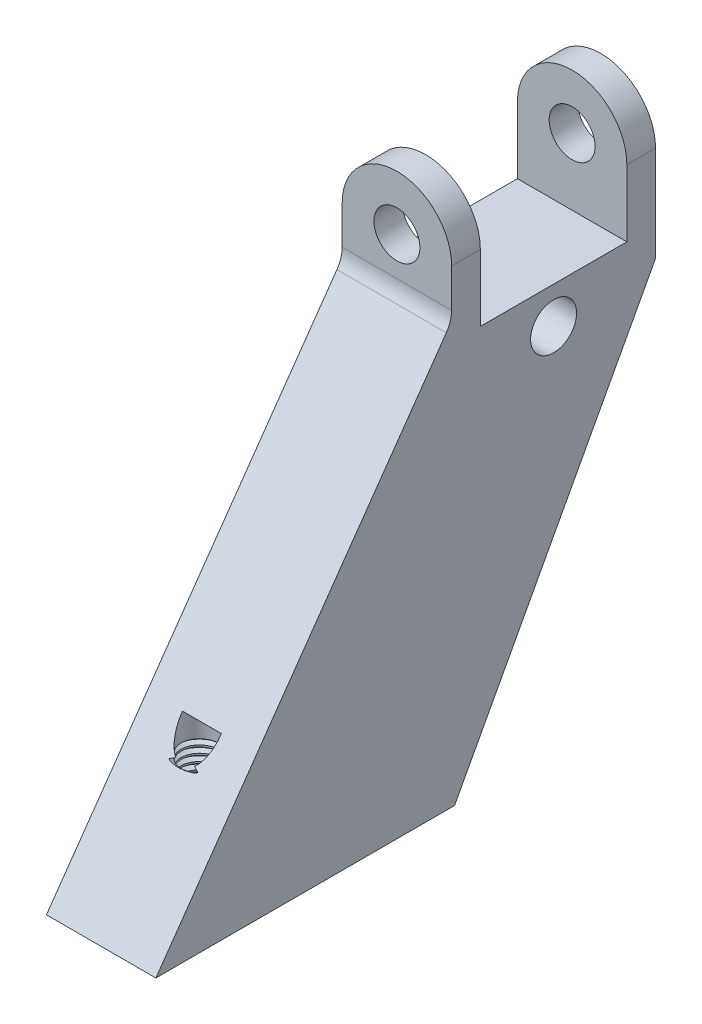
from build123d import *
from build123d.topology import SkipClean

# Parameters (mm, degrees)
SKETCH6_W           = 19.05
SKETCH6_H           = 133.908026583
BOSS_EXTRUDE5_DEPTH = 101.6
SKETCH10_W          = 25.504488372
SKETCH10_H          = 23.275439273
CUT_EXTRUDE6_DEPTH  = 172.247967102
SKETCH12_R          = 4
CUT_EXTRUDE7_DEPTH  = 118.754114563
SKETCH14_R          = 3.4
CUT_EXTRUDE8_DEPTH  = 25
THREAD1_PITCH       = 1.25
THREAD2_PITCH       = 1.25
SKETCH19_R          = 4
CUT_EXTRUDE9_DEPTH  = 130.910986422


with BuildPart() as part:
    # Sketch6 → Boss-Extrude5 (new body)
    with BuildSketch(Plane(origin=(0, 3.43144364, 0), x_dir=(-1, 0, 0), z_dir=(0, 1, 0))):
        with Locations((-3.989422479, 66.954013292)):
            Rectangle(SKETCH6_W, SKETCH6_H)
    extrude(amount=BOSS_EXTRUDE5_DEPTH)

    # Sketch10 → Cut-Extrude6 (cut, through all)
    with BuildSketch(Plane(origin=(13.514422479, 0, 0), x_dir=(0, 0, -1), z_dir=(1, 0, 0))):
        with BuildLine():
            Line((-87.000000104, 3.43144364), (-167.598373303, 3.43144364))
            Line((-167.598373303, 3.43144364), (-168.555842831, 132.882439452))
            Line((-168.555842831, 132.882439452), (-35.504488372, 117.022814853))
            Line((-35.504488372, 117.022814853), (-35.504488372, 78.357297482))
            ThreePointArc((-35.504488372, 78.357297482), (-35.740698196, 76.826253156), (-36.4273611, 75.437589819))
            Line((-36.4273611, 75.437589819), (-87.000000104, 3.43144364))
        make_face()
        Polygon((-35.000000104, 3.43144364), (7.433427186, 3.43144364), (7.433427186, 68.43144364), (0, 68.43144364), align=None)
        with Locations((-17.752244186, 85.069163277)):
            Rectangle(SKETCH10_W, SKETCH10_H)
    extrude(amount=-CUT_EXTRUDE6_DEPTH, mode=Mode.SUBTRACT)

    # Sketch12 → Cut-Extrude7 (cut, through all)
    with BuildSketch(Plane.XY.offset(35.504488372)):
        with Locations((3.989422479, 85.052808464)):
            Circle(SKETCH12_R)
        with BuildLine():
            Line((13.514422479, 85.052808464), (39.943289933, 85.052808464))
            Line((39.943289933, 85.052808464), (39.943289933, 114.808056181))
            Line((39.943289933, 114.808056181), (-16.126426649, 114.808056181))
            Line((-16.126426649, 114.808056181), (-16.126426649, 85.052808464))
            Line((-16.126426649, 85.052808464), (-5.535577521, 85.052808464))
            ThreePointArc((-5.535577521, 85.052808464), (3.989422479, 94.577808464), (13.514422479, 85.052808464))
        make_face()
    extrude(amount=-CUT_EXTRUDE7_DEPTH, mode=Mode.SUBTRACT)

    # Sketch14 → Cut-Extrude8 (cut)
    with BuildSketch(Plane.XZ.offset(-3.43144364)):
        with Locations(Location((3.989422479, 69.500000104, 0), (0, 0, 270))):
            Circle(SKETCH14_R)
        with Locations(Location((3.989422479, 42.500000104, 0), (0, 0, 270))):
            Circle(SKETCH14_R)
    extrude(amount=-CUT_EXTRUDE8_DEPTH, mode=Mode.SUBTRACT)

    # Thread1: the profile of Thread Profile1 profile screwed along a right-hand helix of 16 turns, 8 arcs to a turn; built about Z, then put on its axis
    with SkipClean():  # the faces are left unmerged after this step: merging them gives an invalid solid
        thread1_z = Axis((0, 0, 0), (0, 0, 1))
        thread1_corners = [(3.3997, 0, -0.000173206), (4.076582344, 0, 0.390624998), (4.076582344, 0, 0.546874998), (3.3997, 0, 0.937673201)]
        with BuildLine(mode=Mode.PRIVATE) as thread1_profile:
            Line(thread1_corners[0], thread1_corners[1])
            Line(thread1_corners[1], thread1_corners[2])
            Line(thread1_corners[2], thread1_corners[3])
            Line(thread1_corners[3], thread1_corners[0])
        thread1_cap = Face(thread1_profile.wire())
        thread1_turn_angles = [0, 22.5, 45, 67.5, 90, 112.5, 135, 157.5, 180, 202.5, 225, 247.5, 270, 292.5, 315, 337.5, 360]
        thread1_turn_weights = [1, 0.9238795325112867, 1, 0.9238795325112867, 1, 0.9238795325112867, 1, 0.9238795325112867, 1, 0.9238795325112867, 1, 0.9238795325112867, 1, 0.9238795325112867, 1, 0.9238795325112867, 1]
        thread1_turn_rails = [Edge.make_bspline([Vector(p[0], p[1], 0).rotate(thread1_z, thread1_turn_angles[k]) / thread1_turn_weights[k] + Vector(0, 0, p[2] + THREAD1_PITCH * thread1_turn_angles[k] / 360) for k in range(17)], [0, 0, 0, 1, 1, 2, 2, 3, 3, 4, 4, 5, 5, 6, 6, 7, 7, 8, 8, 8], 2, thread1_turn_weights) for p in thread1_corners]
        thread1_turn_sides = [Face.make_surface_from_curves(thread1_turn_rails[p[0]], thread1_turn_rails[p[1]]) for p in [(0, 1), (1, 2), (2, 3), (3, 0)]]
        thread1 = Plane(origin=(3.989422479, 3.43144364, 42.500000104), x_dir=(1, 0, 0), z_dir=(0, 1, 0)) * Solid(Shell([*[p.moved(Location((0, 0, THREAD1_PITCH * i))) for i in range(16) for p in thread1_turn_sides], thread1_cap, thread1_cap.rotate(thread1_z, 5760).moved(Location((0, 0, THREAD1_PITCH * 5760 / 360)))]))
        add(thread1, mode=Mode.SUBTRACT)

    # Thread2: the profile of Thread Profile2 profile screwed along a right-hand helix of 16 turns, 8 arcs to a turn; built about Z, then put on its axis
    with SkipClean():  # the faces are left unmerged after this step: merging them gives an invalid solid
        thread2_z = Axis((0, 0, 0), (0, 0, 1))
        thread2_corners = [(3.3997, 0, -0.000173206), (4.076582344, 0, 0.390624998), (4.076582344, 0, 0.546874998), (3.3997, 0, 0.937673201)]
        with BuildLine(mode=Mode.PRIVATE) as thread2_profile:
            Line(thread2_corners[0], thread2_corners[1])
            Line(thread2_corners[1], thread2_corners[2])
            Line(thread2_corners[2], thread2_corners[3])
            Line(thread2_corners[3], thread2_corners[0])
        thread2_cap = Face(thread2_profile.wire())
        thread2_turn_angles = [0, 22.5, 45, 67.5, 90, 112.5, 135, 157.5, 180, 202.5, 225, 247.5, 270, 292.5, 315, 337.5, 360]
        thread2_turn_weights = [1, 0.9238795325112867, 1, 0.9238795325112867, 1, 0.9238795325112867, 1, 0.9238795325112867, 1, 0.9238795325112867, 1, 0.9238795325112867, 1, 0.9238795325112867, 1, 0.9238795325112867, 1]
        thread2_turn_rails = [Edge.make_bspline([Vector(p[0], p[1], 0).rotate(thread2_z, thread2_turn_angles[k]) / thread2_turn_weights[k] + Vector(0, 0, p[2] + THREAD2_PITCH * thread2_turn_angles[k] / 360) for k in range(17)], [0, 0, 0, 1, 1, 2, 2, 3, 3, 4, 4, 5, 5, 6, 6, 7, 7, 8, 8, 8], 2, thread2_turn_weights) for p in thread2_corners]
        thread2_turn_sides = [Face.make_surface_from_curves(thread2_turn_rails[p[0]], thread2_turn_rails[p[1]]) for p in [(0, 1), (1, 2), (2, 3), (3, 0)]]
        thread2 = Plane(origin=(3.989422479, 3.43144364, 69.500000104), x_dir=(1, 0, 0), z_dir=(0, 1, 0)) * Solid(Shell([*[p.moved(Location((0, 0, THREAD2_PITCH * i))) for i in range(16) for p in thread2_turn_sides], thread2_cap, thread2_cap.rotate(thread2_z, 5760).moved(Location((0, 0, THREAD2_PITCH * 5760 / 360)))]))
        add(thread2, mode=Mode.SUBTRACT)

    # Sketch19 → Cut-Extrude9 (cut, through all)
    with SkipClean():  # the faces are left unmerged after this step: merging them gives an invalid solid
        with BuildSketch(Plane(origin=(13.514422479, 0, 0), x_dir=(0, 0, -1), z_dir=(1, 0, 0))):
            with Locations(Location((-17.752244186, 67.08144364, 0), (0, 0, 90))):
                Circle(SKETCH19_R)
        extrude(amount=-CUT_EXTRUDE9_DEPTH, mode=Mode.SUBTRACT)


solid = part.part
